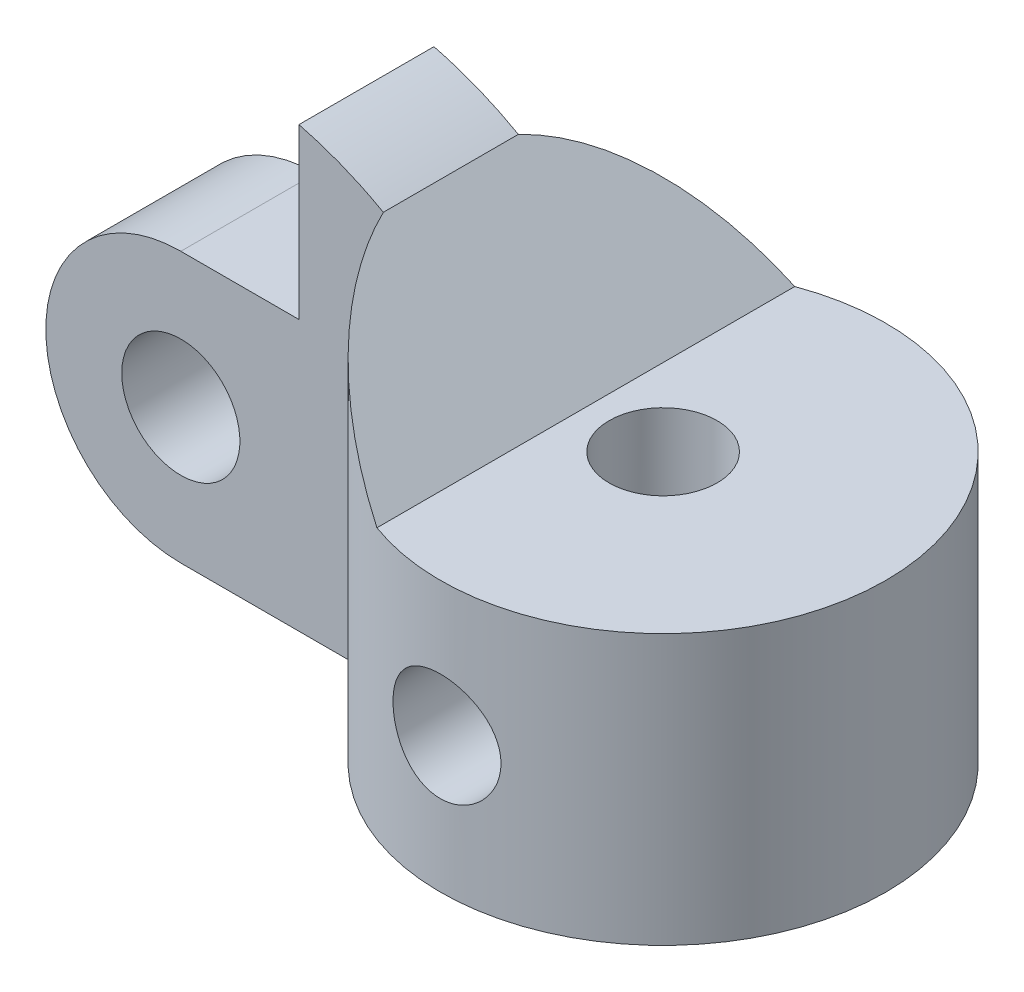
from build123d import *
from build123d.topology import SkipClean

# Parameters (mm, degrees)
SKETCH1_R               = 1.6
BOSS_EXTRUDE1_DEPTH     = 8
CUT_EXTRUDE1_DEPTH      = 21.082666196
CUT_EXTRUDE1_DEPTH_BACK = 21.082666196
SKETCH2_R               = 1.75
SKETCH2_R_2             = 1.6
SKETCH4_W               = 2.5
SKETCH4_H               = 4
BOSS_EXTRUDE3_DEPTH     = 5
CHAMFER1_START          = 8
CHAMFER1_DEPTH          = 4
CHAMFER1_START_2        = -8
CHAMFER1_2_DEPTH        = 16
FILLET2_R               = 10


with BuildPart() as part:
    # Sketch1 → Boss-Extrude1 (new body)
    with BuildSketch(Plane(origin=(0, 0, 0), x_dir=(1, 0, 0), z_dir=(0, 1, 0))):
        with BuildLine():
            Line((-6.289674077, 2), (-16.289674077, 2))
            Line((-16.289674077, 2), (-16.289674077, -2))
            Line((-16.289674077, -2), (-6.289674077, -2))
            ThreePointArc((-6.289674077, -2), (0, -6.6), (6.289674077, -2))
            ThreePointArc((6.289674077, -2), (6.6, 0), (6.289674077, 2))
            ThreePointArc((6.289674077, 2), (0, 6.6), (-6.289674077, 2))
        make_face()
        with Locations(Location((0, 0, 0), (0, 0, 270))):
            Circle(SKETCH1_R, mode=Mode.SUBTRACT)
    extrude(amount=BOSS_EXTRUDE1_DEPTH)

    # Sketch2 → Cut-Extrude1 (cut, two sides: drawn at the far end of the back side and taken through both)
    with BuildSketch(Plane.XY.offset(2).offset(-CUT_EXTRUDE1_DEPTH_BACK)):
        with BuildLine():
            Line((-16.289674077, 8), (-16.289674077, 4))
            ThreePointArc((-16.289674077, 4), (-15.118101202, 6.828427125), (-12.289674077, 8))
            Line((-12.289674077, 8), (-16.289674077, 8))
        make_face()
        with BuildLine():
            Line((-16.289674077, 4), (-16.289674077, 0))
            Line((-16.289674077, 0), (-12.289674077, 0))
            ThreePointArc((-12.289674077, 0), (-15.118101202, 1.171572875), (-16.289674077, 4))
        make_face()
        with Locations(Location((-12.289674077, 4, 0), (0, 0, 180))):
            Circle(SKETCH2_R)
        with Locations((0, 4)):
            Circle(SKETCH2_R_2)
    extrude(amount=CUT_EXTRUDE1_DEPTH + CUT_EXTRUDE1_DEPTH_BACK, mode=Mode.SUBTRACT)

    # Sketch4 → Boss-Extrude3 (add)
    with BuildSketch(Plane(origin=(0, 8, 0), x_dir=(1, 0, 0), z_dir=(0, 1, 0))):
        with Locations((-7.539674077, 0)):
            Rectangle(SKETCH4_W, SKETCH4_H)
    extrude(amount=BOSS_EXTRUDE3_DEPTH)

    # Chamfer1: read off the stored shape, not the designer's step
    # Chamfer1 outline → Chamfer1 (add)
    with SkipClean():  # the faces are left unmerged after this step: merging them gives an invalid solid
        with BuildSketch(Plane(origin=(0, 0, 0), x_dir=(1, 0, 0), z_dir=(0, 1, 0)).offset(CHAMFER1_START)):
            with BuildLine():
                ThreePointArc((-6.289674077, -2), (6.6, 0), (-6.289674077, 2))
                Line((-6.289674077, 2), (-6.289674077, -2))
            make_face()
        extrude(amount=CHAMFER1_DEPTH)

    # Chamfer1 2 outline → Chamfer1 2 (cut)
    with BuildSketch(Plane.XY.offset(CHAMFER1_START_2)):
        Polygon((-2.289674077, 8), (8, 8), (8, 12), (-6.289674077, 12), align=None)
    extrude(amount=CHAMFER1_2_DEPTH, mode=Mode.SUBTRACT)

    # Fillet2
    # the kernel refuses this fillet: 10 mm, written as the material it takes off along each edge
    with BuildSketch(Plane(origin=(-6.289674077, 13, -8.25), x_dir=(4.06555678011955e-10, -1.0, 0), z_dir=(0, 0, 1))) as fillet2_piece_1:
        with BuildLine():
            CenterArc((9.700238938, -4.930095579), FILLET2_R, 150.461416233, 15.474348521)
            Line((-1e-09, -2.5), (0, 0))
            Line((0, 0), (1, 0))
        make_face()
    extrude(amount=16.5, mode=Mode.SUBTRACT)


solid = part.part
